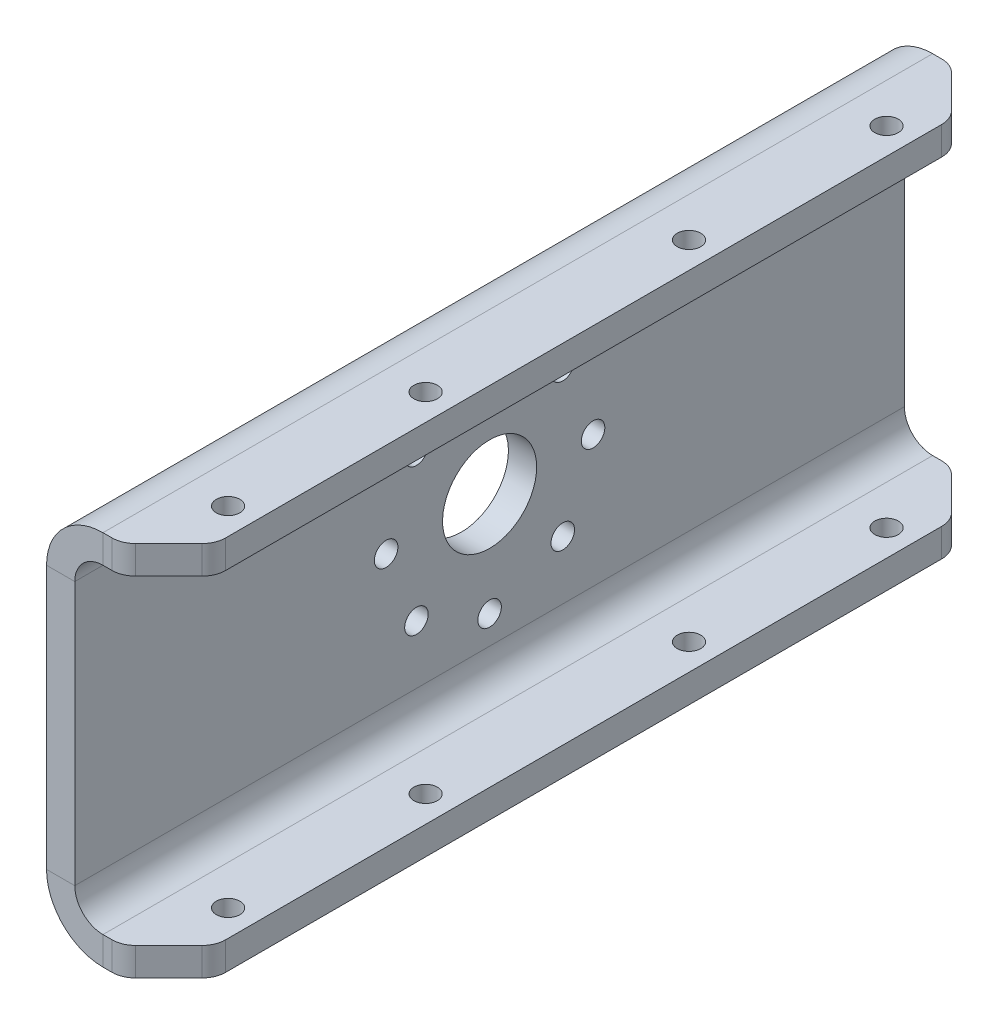
from build123d import *

# Parameters (mm, degrees)
BASE_FLANGE1_DEPTH = 88.2
CHAMFER1_SIZE      = 5
FILLET1_R          = 2.5
SKETCH4_R          = 5
CUT_EXTRUDE1_DEPTH = 92.368703613
SKETCH5_R          = 1.25
CUT_EXTRUDE2_DEPTH = 92.368703613
SKETCH6_R          = 1.25
CUT_EXTRUDE3_DEPTH = 98.361388651


# Sheet-metal steps are written as plain solids
with BuildPart() as part:
    # Sketch1 → Base-Flange1 (new body)
    with BuildSketch(Plane.XY):
        with BuildLine():
            Line((10, -17), (3, -17))
            ThreePointArc((3, -17), (0.878679656, -16.121320344), (0, -14))
            Line((0, -14), (0, 0))
            Line((0, 0), (0, 14))
            ThreePointArc((0, 14), (0.878679656, 16.121320344), (3, 17))
            Line((3, 17), (10, 17))
            Line((10, 17), (10, 20))
            Line((10, 20), (3, 20))
            ThreePointArc((3, 20), (-1.242640687, 18.242640687), (-3, 14))
            Line((-3, 14), (-3, 0))
            Line((-3, 0), (-3, -14))
            ThreePointArc((-3, -14), (-1.242640687, -18.242640687), (3, -20))
            Line((3, -20), (10, -20))
            Line((10, -20), (10, -17))
        make_face()
    extrude(amount=BASE_FLANGE1_DEPTH)

    # Chamfer1
    chamfer1_edges = [part.edges().sort_by_distance(p)[0] for p in [
        (10, 18.5, 0),
        (10, -18.5, 0),
        (10, 18.5, 88.2),
        (10, -18.5, 88.2),
    ]]
    chamfer(chamfer1_edges, length=CHAMFER1_SIZE)

    # Fillet1
    fillet1_edges = [part.edges().sort_by_distance(p)[0] for p in [
        (5, -18.5, 0),
        (10, -18.5, 83.2),
        (10, -18.5, 5),
        (5, 18.5, 0),
        (10, 18.5, 83.2),
        (10, 18.5, 5),
        (5, -18.5, 88.2),
        (5, 18.5, 88.2),
    ]]
    fillet(fillet1_edges, radius=FILLET1_R)

    # Sketch4 → Cut-Extrude1 (cut, through all)
    with BuildSketch(Plane.ZY.offset(3)):
        with Locations(Location((44.1, 0, 0), (0, 0, 270))):
            Circle(SKETCH4_R)
    extrude(amount=-CUT_EXTRUDE1_DEPTH, mode=Mode.SUBTRACT)

    # Sketch5 → Cut-Extrude2 (cut, through all)
    with BuildSketch(Plane.ZY.offset(3)):
        with Locations(Location((44.1, 11, 0), (0, 0, 270))):
            Circle(SKETCH5_R)
        with Locations(Location((51.878174593, 7.778174593, 0), (0, 0, 270))):
            Circle(SKETCH5_R)
        with Locations(Location((55.1, 0, 0), (0, 0, 270))):
            Circle(SKETCH5_R)
        with Locations(Location((51.878174593, -7.778174593, 0), (0, 0, 270))):
            Circle(SKETCH5_R)
        with Locations(Location((44.1, -11, 0), (0, 0, 270))):
            Circle(SKETCH5_R)
        with Locations(Location((36.321825407, -7.778174593, 0), (0, 0, 270))):
            Circle(SKETCH5_R)
        with Locations(Location((33.1, 0, 0), (0, 0, 270))):
            Circle(SKETCH5_R)
        with Locations(Location((36.321825407, 7.778174593, 0), (0, 0, 270))):
            Circle(SKETCH5_R)
    extrude(amount=-CUT_EXTRUDE2_DEPTH, mode=Mode.SUBTRACT)

    # Sketch6 → Cut-Extrude3 (cut, through all)
    with BuildSketch(Plane(origin=(0, 20, 0), x_dir=(1, 0, 0), z_dir=(0, 1, 0))):
        with Locations(Location((7.2, -79.1, 0), (0, 0, 270))):
            Circle(SKETCH6_R)
        with Locations(Location((7.2, -58.1, 0), (0, 0, 270))):
            Circle(SKETCH6_R)
        with Locations(Location((7.2, -30.1, 0), (0, 0, 90))):
            Circle(SKETCH6_R)
        with Locations(Location((7.2, -9.1, 0), (0, 0, 90))):
            Circle(SKETCH6_R)
    extrude(amount=-CUT_EXTRUDE3_DEPTH, mode=Mode.SUBTRACT)


solid = part.part
